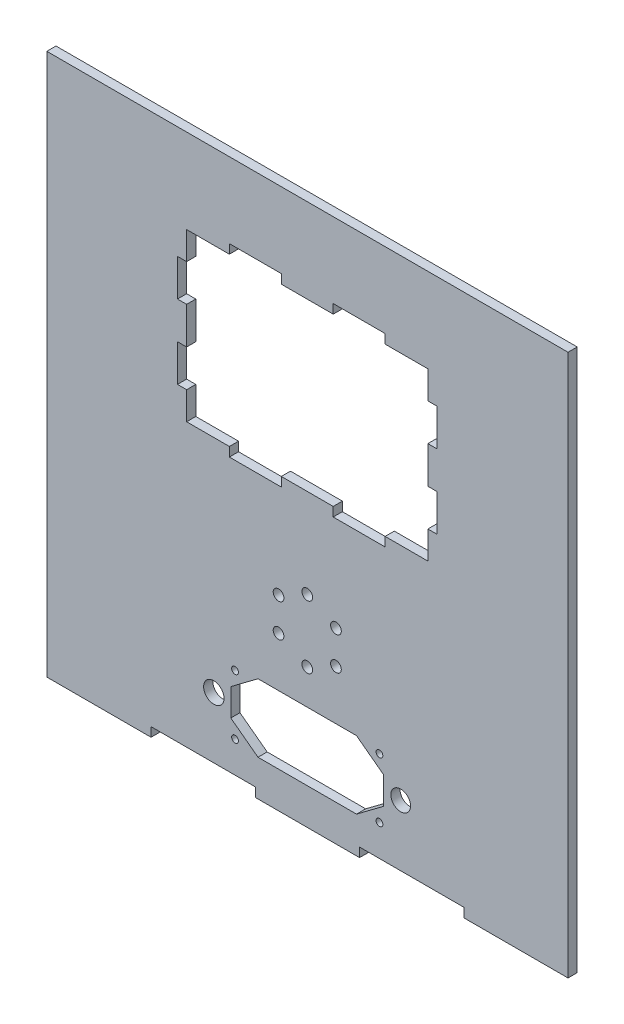
from build123d import *

# Parameters (mm, degrees)
SKETCH1_R           = 1
SKETCH1_R_2         = 3
SKETCH1_R_3         = 2.9
SKETCH1_R_4         = 1.575
BOSS_EXTRUDE3_DEPTH = 2.7


with BuildPart() as part:
    # Sketch1 → Boss-Extrude3 (new body)
    with BuildSketch(Plane.XY):
        Polygon((-45.972294428, -28.145904304), (-45.972294428, -25.445904304), (-15.292294428, -25.445904304), (-15.292294428, -28.145904304), (15.387705572, -28.145904304), (15.387705572, -25.445904304), (46.067705572, -25.445904304), (46.067705572, -28.145904304), (76.747705572, -28.145904304), (76.747705572, -25.445904304), (76.747705572, -23.145904304), (76.747705572, 12.854095696), (76.747705572, 131.354095696), (-76.652294428, 131.354095696), (-76.652294428, 12.854095696), (-76.652294428, -23.145904304), (-76.652294428, -25.445904304), (-76.652294428, -28.145904304), align=None)
        with Locations((-21.25, -16.25)):
            Circle(SKETCH1_R, mode=Mode.SUBTRACT)
        with Locations((-27.5, -7.5)):
            Circle(SKETCH1_R_2, mode=Mode.SUBTRACT)
        with Locations((-21.25, 1.25)):
            Circle(SKETCH1_R, mode=Mode.SUBTRACT)
        with Locations((21.25, -16.25)):
            Circle(SKETCH1_R, mode=Mode.SUBTRACT)
        with Locations((27.5, -7.5)):
            Circle(SKETCH1_R_3, mode=Mode.SUBTRACT)
        with Locations((21.25, 1.25)):
            Circle(SKETCH1_R, mode=Mode.SUBTRACT)
        with Locations((0, 31.25)):
            Circle(SKETCH1_R_4, mode=Mode.SUBTRACT)
        with Locations((0, 12.75)):
            Circle(SKETCH1_R_4, mode=Mode.SUBTRACT)
        with Locations((-8.443747687, 17.125)):
            Circle(SKETCH1_R_4, mode=Mode.SUBTRACT)
        with Locations((-8.443747687, 26.875)):
            Circle(SKETCH1_R_4, mode=Mode.SUBTRACT)
        with Locations((8.443747687, 26.875)):
            Circle(SKETCH1_R_4, mode=Mode.SUBTRACT)
        with Locations((8.443747687, 17.125)):
            Circle(SKETCH1_R_4, mode=Mode.SUBTRACT)
        Polygon((-22.5, -3.5), (-14.5, 2.5), (14.5, 2.5), (22.5, -3.5), (22.5, -11.5), (14.5, -17.5), (0, -17.5), (-14.5, -17.5), (-22.5, -11.5), align=None, mode=Mode.SUBTRACT)
        Polygon((35.5, 57.5), (22.92, 57.5), (22.92, 54.8), (7.64, 54.8), (7.64, 57.5), (-7.64, 57.5), (-7.64, 54.8), (-22.92, 54.8), (-22.92, 57.5), (-35.5, 57.5), (-35.5, 65.68), (-38.2, 65.68), (-38.2, 76.56), (-35.5, 76.56), (-35.5, 87.44), (-38.2, 87.44), (-38.2, 98.32), (-35.5, 98.32), (-35.5, 106.5), (-22.92, 106.5), (-22.92, 109.2), (-7.64, 109.2), (-7.64, 106.5), (7.64, 106.5), (7.64, 109.2), (22.92, 109.2), (22.92, 106.5), (35.5, 106.5), (35.5, 98.32), (38.2, 98.32), (38.2, 87.44), (35.5, 87.44), (35.5, 76.56), (38.2, 76.56), (38.2, 65.68), (35.5, 65.68), align=None, mode=Mode.SUBTRACT)
    extrude(amount=BOSS_EXTRUDE3_DEPTH)


solid = part.part
